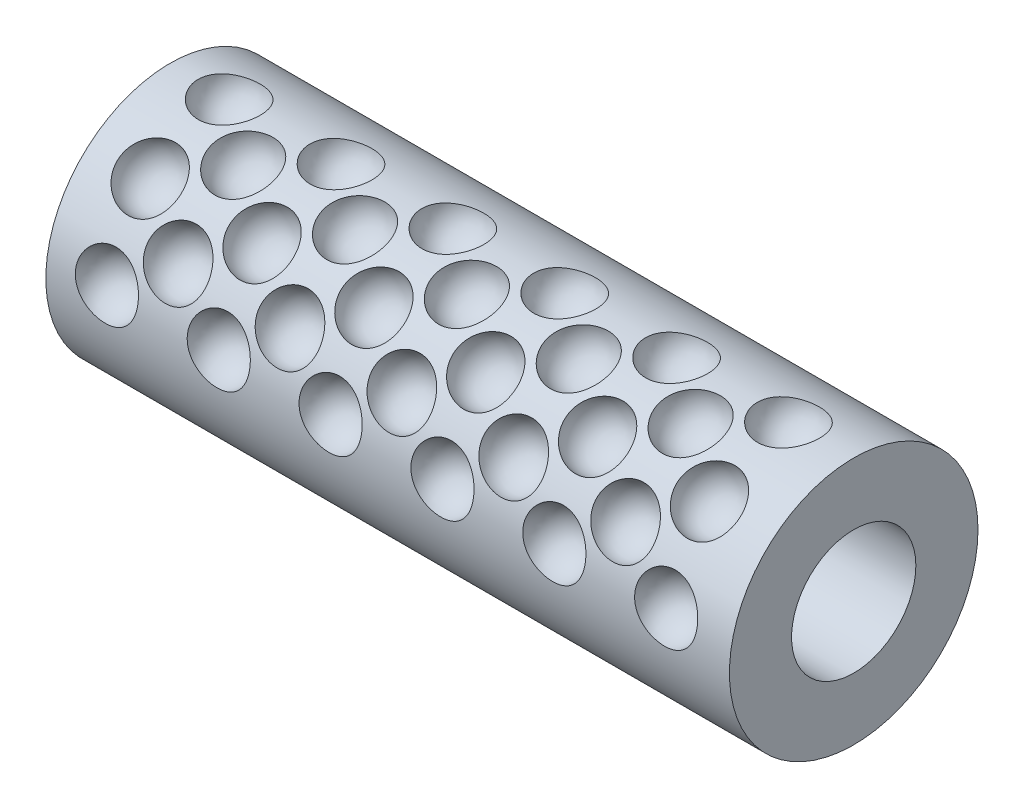
from build123d import *

# Parameters (mm, degrees)
SKETCH1_R           = 5.08
BOSS_EXTRUDE1_DEPTH = 13.97
LPATTERN1_COUNT     = 6
LPATTERN1_PITCH     = 4.572
CIRPATTERN1_COUNT   = 3
CIRPATTERN1_ANGLE   = 80
LPATTERN3_COUNT     = 5
LPATTERN3_PITCH     = 4.572
CIRPATTERN2_COUNT   = 2
CIRPATTERN2_ANGLE   = 40
SKETCH4_R           = 2.54
CUT_EXTRUDE1_DEPTH  = 29.848854529


with BuildPart() as part:
    # Sketch1 → Boss-Extrude1 (new, symmetric)
    with BuildSketch(Plane(origin=(0, 0, 0), x_dir=(0, 0, -1), z_dir=(1, 0, 0))):
        Circle(SKETCH1_R)
    extrude(amount=BOSS_EXTRUDE1_DEPTH, both=True)

    # Sketch7 → Primary Dimple (revolve, cut)
    with BuildSketch(Plane.ZY.offset(11.557)):
        with BuildLine():
            Line((0, 5.08), (0, 3.81))
            ThreePointArc((0, 3.81), (-0.898025612, 4.181974388), (-1.27, 5.08))
            Line((-1.27, 5.08), (-1.27, 5.441785192))
            Line((-1.27, 5.441785192), (0, 5.441785192))
            Line((0, 5.441785192), (0, 5.08))
        make_face()
    primary_dimple = revolve(axis=Axis((-11.557, 0, 0), (0, 1, 0)), mode=Mode.SUBTRACT)

    # LPattern1: Primary Dimple ×6
    with Locations(*[(i * LPATTERN1_PITCH, 0, 0) for i in range(1, LPATTERN1_COUNT)]):
        add(primary_dimple, mode=Mode.SUBTRACT)

    # CirPattern1: Primary Dimple ×3 about axis
    cirpattern1_axis = Axis((0, 0, 0), (1, 0, 0))
    for i in range(1, CIRPATTERN1_COUNT):
        add(primary_dimple.rotate(cirpattern1_axis, i * CIRPATTERN1_ANGLE / (CIRPATTERN1_COUNT - 1)), mode=Mode.SUBTRACT)

    # CirPattern1 copy 1 sketch → CirPattern1 copy 1 (revolve, cut)
    with BuildSketch(Plane(origin=(-6.985, 0, 0), x_dir=(-6.982962677686267e-15, -0.6427876096865406, 0.766044443118977), z_dir=(-1, 0, 0))):
        with BuildLine():
            Line((0, 5.08), (0, 3.81))
            ThreePointArc((0, 3.81), (-0.898025612, 4.181974388), (-1.27, 5.08))
            Line((-1.27, 5.08), (-1.27, 5.441785192))
            Line((-1.27, 5.441785192), (0, 5.441785192))
            Line((0, 5.441785192), (0, 5.08))
        make_face()
    revolve(axis=Axis((-6.985, 0, 0), (0, 0.766044443118977, 0.6427876096865406)), mode=Mode.SUBTRACT)

    # CirPattern1 copy 2 sketch → CirPattern1 copy 2 (revolve, cut)
    with BuildSketch(Plane(origin=(-6.985, 0, 0), x_dir=(-6.982962677686267e-15, -0.9848077530122086, 0.17364817766692714), z_dir=(-1, 0, 0))):
        with BuildLine():
            Line((0, 5.08), (0, 3.81))
            ThreePointArc((0, 3.81), (-0.898025612, 4.181974388), (-1.27, 5.08))
            Line((-1.27, 5.08), (-1.27, 5.441785192))
            Line((-1.27, 5.441785192), (0, 5.441785192))
            Line((0, 5.441785192), (0, 5.08))
        make_face()
    revolve(axis=Axis((-6.985, 0, 0), (0, 0.17364817766692714, 0.9848077530122086)), mode=Mode.SUBTRACT)

    # CirPattern1 copy 3 sketch → CirPattern1 copy 3 (revolve, cut)
    with BuildSketch(Plane(origin=(-2.413, 0, 0), x_dir=(-6.982962677686267e-15, -0.6427876096865406, 0.766044443118977), z_dir=(-1, 0, 0))):
        with BuildLine():
            Line((0, 5.08), (0, 3.81))
            ThreePointArc((0, 3.81), (-0.898025612, 4.181974388), (-1.27, 5.08))
            Line((-1.27, 5.08), (-1.27, 5.441785192))
            Line((-1.27, 5.441785192), (0, 5.441785192))
            Line((0, 5.441785192), (0, 5.08))
        make_face()
    revolve(axis=Axis((-2.413, 0, 0), (0, 0.766044443118977, 0.6427876096865406)), mode=Mode.SUBTRACT)

    # CirPattern1 copy 4 sketch → CirPattern1 copy 4 (revolve, cut)
    with BuildSketch(Plane(origin=(-2.413, 0, 0), x_dir=(-6.982962677686267e-15, -0.9848077530122086, 0.17364817766692714), z_dir=(-1, 0, 0))):
        with BuildLine():
            Line((0, 5.08), (0, 3.81))
            ThreePointArc((0, 3.81), (-0.898025612, 4.181974388), (-1.27, 5.08))
            Line((-1.27, 5.08), (-1.27, 5.441785192))
            Line((-1.27, 5.441785192), (0, 5.441785192))
            Line((0, 5.441785192), (0, 5.08))
        make_face()
    revolve(axis=Axis((-2.413, 0, 0), (0, 0.17364817766692714, 0.9848077530122086)), mode=Mode.SUBTRACT)

    # CirPattern1 copy 5 sketch → CirPattern1 copy 5 (revolve, cut)
    with BuildSketch(Plane(origin=(2.159, 0, 0), x_dir=(-6.982962677686267e-15, -0.6427876096865406, 0.766044443118977), z_dir=(-1, 0, 0))):
        with BuildLine():
            Line((0, 5.08), (0, 3.81))
            ThreePointArc((0, 3.81), (-0.898025612, 4.181974388), (-1.27, 5.08))
            Line((-1.27, 5.08), (-1.27, 5.441785192))
            Line((-1.27, 5.441785192), (0, 5.441785192))
            Line((0, 5.441785192), (0, 5.08))
        make_face()
    revolve(axis=Axis((2.159, 0, 0), (0, 0.766044443118977, 0.6427876096865406)), mode=Mode.SUBTRACT)

    # CirPattern1 copy 6 sketch → CirPattern1 copy 6 (revolve, cut)
    with BuildSketch(Plane(origin=(2.159, 0, 0), x_dir=(-6.982962677686267e-15, -0.9848077530122086, 0.17364817766692714), z_dir=(-1, 0, 0))):
        with BuildLine():
            Line((0, 5.08), (0, 3.81))
            ThreePointArc((0, 3.81), (-0.898025612, 4.181974388), (-1.27, 5.08))
            Line((-1.27, 5.08), (-1.27, 5.441785192))
            Line((-1.27, 5.441785192), (0, 5.441785192))
            Line((0, 5.441785192), (0, 5.08))
        make_face()
    revolve(axis=Axis((2.159, 0, 0), (0, 0.17364817766692714, 0.9848077530122086)), mode=Mode.SUBTRACT)

    # CirPattern1 copy 7 sketch → CirPattern1 copy 7 (revolve, cut)
    with BuildSketch(Plane(origin=(6.731, 0, 0), x_dir=(-6.982962677686267e-15, -0.6427876096865406, 0.766044443118977), z_dir=(-1, 0, 0))):
        with BuildLine():
            Line((0, 5.08), (0, 3.81))
            ThreePointArc((0, 3.81), (-0.898025612, 4.181974388), (-1.27, 5.08))
            Line((-1.27, 5.08), (-1.27, 5.441785192))
            Line((-1.27, 5.441785192), (0, 5.441785192))
            Line((0, 5.441785192), (0, 5.08))
        make_face()
    revolve(axis=Axis((6.731, 0, 0), (0, 0.766044443118977, 0.6427876096865406)), mode=Mode.SUBTRACT)

    # CirPattern1 copy 8 sketch → CirPattern1 copy 8 (revolve, cut)
    with BuildSketch(Plane(origin=(6.731, 0, 0), x_dir=(-6.982962677686267e-15, -0.9848077530122086, 0.17364817766692714), z_dir=(-1, 0, 0))):
        with BuildLine():
            Line((0, 5.08), (0, 3.81))
            ThreePointArc((0, 3.81), (-0.898025612, 4.181974388), (-1.27, 5.08))
            Line((-1.27, 5.08), (-1.27, 5.441785192))
            Line((-1.27, 5.441785192), (0, 5.441785192))
            Line((0, 5.441785192), (0, 5.08))
        make_face()
    revolve(axis=Axis((6.731, 0, 0), (0, 0.17364817766692714, 0.9848077530122086)), mode=Mode.SUBTRACT)

    # CirPattern1 copy 9 sketch → CirPattern1 copy 9 (revolve, cut)
    with BuildSketch(Plane(origin=(11.303, 0, 0), x_dir=(-6.982962677686267e-15, -0.6427876096865406, 0.766044443118977), z_dir=(-1, 0, 0))):
        with BuildLine():
            Line((0, 5.08), (0, 3.81))
            ThreePointArc((0, 3.81), (-0.898025612, 4.181974388), (-1.27, 5.08))
            Line((-1.27, 5.08), (-1.27, 5.441785192))
            Line((-1.27, 5.441785192), (0, 5.441785192))
            Line((0, 5.441785192), (0, 5.08))
        make_face()
    revolve(axis=Axis((11.303, 0, 0), (0, 0.766044443118977, 0.6427876096865406)), mode=Mode.SUBTRACT)

    # CirPattern1 copy 10 sketch → CirPattern1 copy 10 (revolve, cut)
    with BuildSketch(Plane(origin=(11.303, 0, 0), x_dir=(-6.982962677686267e-15, -0.9848077530122086, 0.17364817766692714), z_dir=(-1, 0, 0))):
        with BuildLine():
            Line((0, 5.08), (0, 3.81))
            ThreePointArc((0, 3.81), (-0.898025612, 4.181974388), (-1.27, 5.08))
            Line((-1.27, 5.08), (-1.27, 5.441785192))
            Line((-1.27, 5.441785192), (0, 5.441785192))
            Line((0, 5.441785192), (0, 5.08))
        make_face()
    revolve(axis=Axis((11.303, 0, 0), (0, 0.17364817766692714, 0.9848077530122086)), mode=Mode.SUBTRACT)

    # Mirror3: Primary Dimple across plane
    add(primary_dimple.mirror(Plane(origin=(0, 0, 0), x_dir=(0, -0.7071067811865561, 0.7071067811865389), z_dir=(0, 0.7071067811865389, 0.7071067811865561))), mode=Mode.SUBTRACT)

    # Mirror3 copy 1 sketch → Mirror3 copy 1 (revolve, cut)
    with BuildSketch(Plane(origin=(-6.985, 0, 0), x_dir=(0, -1, 0), z_dir=(-1, 0, 0))):
        with BuildLine():
            Line((0, -5.08), (0, -3.81))
            ThreePointArc((0, -3.81), (-0.898025612, -4.181974388), (-1.27, -5.08))
            Line((-1.27, -5.08), (-1.27, -5.441785192))
            Line((-1.27, -5.441785192), (0, -5.441785192))
            Line((0, -5.441785192), (0, -5.08))
        make_face()
    revolve(axis=Axis((-6.985, 0, 0), (0, 0, 1)), mode=Mode.SUBTRACT)

    # Mirror3 copy 2 sketch → Mirror3 copy 2 (revolve, cut)
    with BuildSketch(Plane(origin=(-2.413, 0, 0), x_dir=(0, -1, 0), z_dir=(-1, 0, 0))):
        with BuildLine():
            Line((0, -5.08), (0, -3.81))
            ThreePointArc((0, -3.81), (-0.898025612, -4.181974388), (-1.27, -5.08))
            Line((-1.27, -5.08), (-1.27, -5.441785192))
            Line((-1.27, -5.441785192), (0, -5.441785192))
            Line((0, -5.441785192), (0, -5.08))
        make_face()
    revolve(axis=Axis((-2.413, 0, 0), (0, 0, 1)), mode=Mode.SUBTRACT)

    # Mirror3 copy 3 sketch → Mirror3 copy 3 (revolve, cut)
    with BuildSketch(Plane(origin=(2.159, 0, 0), x_dir=(0, -1, 0), z_dir=(-1, 0, 0))):
        with BuildLine():
            Line((0, -5.08), (0, -3.81))
            ThreePointArc((0, -3.81), (-0.898025612, -4.181974388), (-1.27, -5.08))
            Line((-1.27, -5.08), (-1.27, -5.441785192))
            Line((-1.27, -5.441785192), (0, -5.441785192))
            Line((0, -5.441785192), (0, -5.08))
        make_face()
    revolve(axis=Axis((2.159, 0, 0), (0, 0, 1)), mode=Mode.SUBTRACT)

    # Mirror3 copy 4 sketch → Mirror3 copy 4 (revolve, cut)
    with BuildSketch(Plane(origin=(6.731, 0, 0), x_dir=(0, -1, 0), z_dir=(-1, 0, 0))):
        with BuildLine():
            Line((0, -5.08), (0, -3.81))
            ThreePointArc((0, -3.81), (-0.898025612, -4.181974388), (-1.27, -5.08))
            Line((-1.27, -5.08), (-1.27, -5.441785192))
            Line((-1.27, -5.441785192), (0, -5.441785192))
            Line((0, -5.441785192), (0, -5.08))
        make_face()
    revolve(axis=Axis((6.731, 0, 0), (0, 0, 1)), mode=Mode.SUBTRACT)

    # Mirror3 copy 5 sketch → Mirror3 copy 5 (revolve, cut)
    with BuildSketch(Plane(origin=(11.303, 0, 0), x_dir=(0, -1, 0), z_dir=(-1, 0, 0))):
        with BuildLine():
            Line((0, -5.08), (0, -3.81))
            ThreePointArc((0, -3.81), (-0.898025612, -4.181974388), (-1.27, -5.08))
            Line((-1.27, -5.08), (-1.27, -5.441785192))
            Line((-1.27, -5.441785192), (0, -5.441785192))
            Line((0, -5.441785192), (0, -5.08))
        make_face()
    revolve(axis=Axis((11.303, 0, 0), (0, 0, 1)), mode=Mode.SUBTRACT)

    # Mirror3 copy 6 sketch → Mirror3 copy 6 (revolve, cut)
    with BuildSketch(Plane(origin=(-11.557, 0, 0), x_dir=(-6.982962677686267e-15, -0.7660444431189927, 0.6427876096865218), z_dir=(-1, 0, 0))):
        with BuildLine():
            Line((0, -5.08), (0, -3.81))
            ThreePointArc((0, -3.81), (-0.898025612, -4.181974388), (-1.27, -5.08))
            Line((-1.27, -5.08), (-1.27, -5.441785192))
            Line((-1.27, -5.441785192), (0, -5.441785192))
            Line((0, -5.441785192), (0, -5.08))
        make_face()
    revolve(axis=Axis((-11.557, 0, 0), (0, 0.6427876096865219, 0.7660444431189927)), mode=Mode.SUBTRACT)

    # Mirror3 copy 7 sketch → Mirror3 copy 7 (revolve, cut)
    with BuildSketch(Plane(origin=(-11.557, 0, 0), x_dir=(-6.982962677686267e-15, -0.1736481776669511, 0.9848077530122044), z_dir=(-1, 0, 0))):
        with BuildLine():
            Line((0, -5.08), (0, -3.81))
            ThreePointArc((0, -3.81), (-0.898025612, -4.181974388), (-1.27, -5.08))
            Line((-1.27, -5.08), (-1.27, -5.441785192))
            Line((-1.27, -5.441785192), (0, -5.441785192))
            Line((0, -5.441785192), (0, -5.08))
        make_face()
    revolve(axis=Axis((-11.557, 0, 0), (0, 0.9848077530122044, 0.1736481776669512)), mode=Mode.SUBTRACT)

    # Mirror3 copy 8 sketch → Mirror3 copy 8 (revolve, cut)
    with BuildSketch(Plane(origin=(-6.985, 0, 0), x_dir=(-6.982962677686267e-15, -0.7660444431189927, 0.6427876096865218), z_dir=(-1, 0, 0))):
        with BuildLine():
            Line((0, -5.08), (0, -3.81))
            ThreePointArc((0, -3.81), (-0.898025612, -4.181974388), (-1.27, -5.08))
            Line((-1.27, -5.08), (-1.27, -5.441785192))
            Line((-1.27, -5.441785192), (0, -5.441785192))
            Line((0, -5.441785192), (0, -5.08))
        make_face()
    revolve(axis=Axis((-6.985, 0, 0), (0, 0.6427876096865219, 0.7660444431189927)), mode=Mode.SUBTRACT)

    # Mirror3 copy 9 sketch → Mirror3 copy 9 (revolve, cut)
    with BuildSketch(Plane(origin=(-6.985, 0, 0), x_dir=(-6.982962677686267e-15, -0.1736481776669511, 0.9848077530122044), z_dir=(-1, 0, 0))):
        with BuildLine():
            Line((0, -5.08), (0, -3.81))
            ThreePointArc((0, -3.81), (-0.898025612, -4.181974388), (-1.27, -5.08))
            Line((-1.27, -5.08), (-1.27, -5.441785192))
            Line((-1.27, -5.441785192), (0, -5.441785192))
            Line((0, -5.441785192), (0, -5.08))
        make_face()
    revolve(axis=Axis((-6.985, 0, 0), (0, 0.9848077530122044, 0.1736481776669512)), mode=Mode.SUBTRACT)

    # Mirror3 copy 10 sketch → Mirror3 copy 10 (revolve, cut)
    with BuildSketch(Plane(origin=(-2.413, 0, 0), x_dir=(-6.982962677686267e-15, -0.7660444431189927, 0.6427876096865218), z_dir=(-1, 0, 0))):
        with BuildLine():
            Line((0, -5.08), (0, -3.81))
            ThreePointArc((0, -3.81), (-0.898025612, -4.181974388), (-1.27, -5.08))
            Line((-1.27, -5.08), (-1.27, -5.441785192))
            Line((-1.27, -5.441785192), (0, -5.441785192))
            Line((0, -5.441785192), (0, -5.08))
        make_face()
    revolve(axis=Axis((-2.413, 0, 0), (0, 0.6427876096865219, 0.7660444431189927)), mode=Mode.SUBTRACT)

    # Mirror3 copy 11 sketch → Mirror3 copy 11 (revolve, cut)
    with BuildSketch(Plane(origin=(-2.413, 0, 0), x_dir=(-6.982962677686267e-15, -0.1736481776669511, 0.9848077530122044), z_dir=(-1, 0, 0))):
        with BuildLine():
            Line((0, -5.08), (0, -3.81))
            ThreePointArc((0, -3.81), (-0.898025612, -4.181974388), (-1.27, -5.08))
            Line((-1.27, -5.08), (-1.27, -5.441785192))
            Line((-1.27, -5.441785192), (0, -5.441785192))
            Line((0, -5.441785192), (0, -5.08))
        make_face()
    revolve(axis=Axis((-2.413, 0, 0), (0, 0.9848077530122044, 0.1736481776669512)), mode=Mode.SUBTRACT)

    # Mirror3 copy 12 sketch → Mirror3 copy 12 (revolve, cut)
    with BuildSketch(Plane(origin=(2.159, 0, 0), x_dir=(-6.982962677686267e-15, -0.7660444431189927, 0.6427876096865218), z_dir=(-1, 0, 0))):
        with BuildLine():
            Line((0, -5.08), (0, -3.81))
            ThreePointArc((0, -3.81), (-0.898025612, -4.181974388), (-1.27, -5.08))
            Line((-1.27, -5.08), (-1.27, -5.441785192))
            Line((-1.27, -5.441785192), (0, -5.441785192))
            Line((0, -5.441785192), (0, -5.08))
        make_face()
    revolve(axis=Axis((2.159, 0, 0), (0, 0.6427876096865219, 0.7660444431189927)), mode=Mode.SUBTRACT)

    # Mirror3 copy 13 sketch → Mirror3 copy 13 (revolve, cut)
    with BuildSketch(Plane(origin=(2.159, 0, 0), x_dir=(-6.982962677686267e-15, -0.1736481776669511, 0.9848077530122044), z_dir=(-1, 0, 0))):
        with BuildLine():
            Line((0, -5.08), (0, -3.81))
            ThreePointArc((0, -3.81), (-0.898025612, -4.181974388), (-1.27, -5.08))
            Line((-1.27, -5.08), (-1.27, -5.441785192))
            Line((-1.27, -5.441785192), (0, -5.441785192))
            Line((0, -5.441785192), (0, -5.08))
        make_face()
    revolve(axis=Axis((2.159, 0, 0), (0, 0.9848077530122044, 0.1736481776669512)), mode=Mode.SUBTRACT)

    # Mirror3 copy 14 sketch → Mirror3 copy 14 (revolve, cut)
    with BuildSketch(Plane(origin=(6.731, 0, 0), x_dir=(-6.982962677686267e-15, -0.7660444431189927, 0.6427876096865218), z_dir=(-1, 0, 0))):
        with BuildLine():
            Line((0, -5.08), (0, -3.81))
            ThreePointArc((0, -3.81), (-0.898025612, -4.181974388), (-1.27, -5.08))
            Line((-1.27, -5.08), (-1.27, -5.441785192))
            Line((-1.27, -5.441785192), (0, -5.441785192))
            Line((0, -5.441785192), (0, -5.08))
        make_face()
    revolve(axis=Axis((6.731, 0, 0), (0, 0.6427876096865219, 0.7660444431189927)), mode=Mode.SUBTRACT)

    # Mirror3 copy 15 sketch → Mirror3 copy 15 (revolve, cut)
    with BuildSketch(Plane(origin=(6.731, 0, 0), x_dir=(-6.982962677686267e-15, -0.1736481776669511, 0.9848077530122044), z_dir=(-1, 0, 0))):
        with BuildLine():
            Line((0, -5.08), (0, -3.81))
            ThreePointArc((0, -3.81), (-0.898025612, -4.181974388), (-1.27, -5.08))
            Line((-1.27, -5.08), (-1.27, -5.441785192))
            Line((-1.27, -5.441785192), (0, -5.441785192))
            Line((0, -5.441785192), (0, -5.08))
        make_face()
    revolve(axis=Axis((6.731, 0, 0), (0, 0.9848077530122044, 0.1736481776669512)), mode=Mode.SUBTRACT)

    # Mirror3 copy 16 sketch → Mirror3 copy 16 (revolve, cut)
    with BuildSketch(Plane(origin=(11.303, 0, 0), x_dir=(-6.982962677686267e-15, -0.7660444431189927, 0.6427876096865218), z_dir=(-1, 0, 0))):
        with BuildLine():
            Line((0, -5.08), (0, -3.81))
            ThreePointArc((0, -3.81), (-0.898025612, -4.181974388), (-1.27, -5.08))
            Line((-1.27, -5.08), (-1.27, -5.441785192))
            Line((-1.27, -5.441785192), (0, -5.441785192))
            Line((0, -5.441785192), (0, -5.08))
        make_face()
    revolve(axis=Axis((11.303, 0, 0), (0, 0.6427876096865219, 0.7660444431189927)), mode=Mode.SUBTRACT)

    # Mirror3 copy 17 sketch → Mirror3 copy 17 (revolve, cut)
    with BuildSketch(Plane(origin=(11.303, 0, 0), x_dir=(-6.982962677686267e-15, -0.1736481776669511, 0.9848077530122044), z_dir=(-1, 0, 0))):
        with BuildLine():
            Line((0, -5.08), (0, -3.81))
            ThreePointArc((0, -3.81), (-0.898025612, -4.181974388), (-1.27, -5.08))
            Line((-1.27, -5.08), (-1.27, -5.441785192))
            Line((-1.27, -5.441785192), (0, -5.441785192))
            Line((0, -5.441785192), (0, -5.08))
        make_face()
    revolve(axis=Axis((11.303, 0, 0), (0, 0.9848077530122044, 0.1736481776669512)), mode=Mode.SUBTRACT)

    # Sketch13 → Secondary Dimple (revolve, cut)
    with BuildSketch(Plane.ZY.offset(9.271)):
        with BuildLine():
            Line((1.737462328, 4.773638514), (1.303096746, 3.580228885))
            ThreePointArc((1.303096746, 3.580228885), (0.586451439, 4.236913321), (0.5440527, 5.208004096))
            Line((0.5440527, 5.208004096), (0.665675063, 5.542158792))
            Line((0.665675063, 5.542158792), (1.859084691, 5.10779321))
            Line((1.859084691, 5.10779321), (1.737462328, 4.773638514))
        make_face()
    secondary_dimple = revolve(axis=Axis((-9.271, 2.139091027, 0.778565462), (-2.3065863022557455e-15, 0.9396926207859081, 0.34202014332566943)), mode=Mode.SUBTRACT)

    # LPattern3: Secondary Dimple ×5
    with Locations(*[(i * LPATTERN3_PITCH, 0, 0) for i in range(1, LPATTERN3_COUNT)]):
        add(secondary_dimple, mode=Mode.SUBTRACT)

    # CirPattern2: Secondary Dimple ×2 about axis
    cirpattern2_axis = Axis((-13.97, 0, 0), (1, 0, 0))
    for i in range(1, CIRPATTERN2_COUNT):
        add(secondary_dimple.rotate(cirpattern2_axis, i * CIRPATTERN2_ANGLE / (CIRPATTERN2_COUNT - 1)), mode=Mode.SUBTRACT)

    # CirPattern2 copy 1 sketch → CirPattern2 copy 1 (revolve, cut)
    with BuildSketch(Plane(origin=(-4.699, 0, 0), x_dir=(-6.982962677686267e-15, -0.6427876096865406, 0.766044443118977), z_dir=(-1, 0, 0))):
        with BuildLine():
            Line((1.737462328, 4.773638514), (1.303096746, 3.580228885))
            ThreePointArc((1.303096746, 3.580228885), (0.586451439, 4.236913321), (0.5440527, 5.208004096))
            Line((0.5440527, 5.208004096), (0.665675063, 5.542158792))
            Line((0.665675063, 5.542158792), (1.859084691, 5.10779321))
            Line((1.859084691, 5.10779321), (1.737462328, 4.773638514))
        make_face()
    revolve(axis=Axis((-4.699, 1.138186562, 1.971396954), (-2.3065863022557455e-15, 0.4999999999999979, 0.8660254037844399)), mode=Mode.SUBTRACT)

    # CirPattern2 copy 2 sketch → CirPattern2 copy 2 (revolve, cut)
    with BuildSketch(Plane(origin=(-0.127, 0, 0), x_dir=(-6.982962677686267e-15, -0.6427876096865406, 0.766044443118977), z_dir=(-1, 0, 0))):
        with BuildLine():
            Line((1.737462328, 4.773638514), (1.303096746, 3.580228885))
            ThreePointArc((1.303096746, 3.580228885), (0.586451439, 4.236913321), (0.5440527, 5.208004096))
            Line((0.5440527, 5.208004096), (0.665675063, 5.542158792))
            Line((0.665675063, 5.542158792), (1.859084691, 5.10779321))
            Line((1.859084691, 5.10779321), (1.737462328, 4.773638514))
        make_face()
    revolve(axis=Axis((-0.127, 1.138186562, 1.971396954), (-2.3065863022557455e-15, 0.4999999999999979, 0.8660254037844399)), mode=Mode.SUBTRACT)

    # CirPattern2 copy 3 sketch → CirPattern2 copy 3 (revolve, cut)
    with BuildSketch(Plane(origin=(4.445, 0, 0), x_dir=(-6.982962677686267e-15, -0.6427876096865406, 0.766044443118977), z_dir=(-1, 0, 0))):
        with BuildLine():
            Line((1.737462328, 4.773638514), (1.303096746, 3.580228885))
            ThreePointArc((1.303096746, 3.580228885), (0.586451439, 4.236913321), (0.5440527, 5.208004096))
            Line((0.5440527, 5.208004096), (0.665675063, 5.542158792))
            Line((0.665675063, 5.542158792), (1.859084691, 5.10779321))
            Line((1.859084691, 5.10779321), (1.737462328, 4.773638514))
        make_face()
    revolve(axis=Axis((4.445, 1.138186562, 1.971396954), (-2.3065863022557455e-15, 0.4999999999999979, 0.8660254037844399)), mode=Mode.SUBTRACT)

    # CirPattern2 copy 4 sketch → CirPattern2 copy 4 (revolve, cut)
    with BuildSketch(Plane(origin=(9.017, 0, 0), x_dir=(-6.982962677686267e-15, -0.6427876096865406, 0.766044443118977), z_dir=(-1, 0, 0))):
        with BuildLine():
            Line((1.737462328, 4.773638514), (1.303096746, 3.580228885))
            ThreePointArc((1.303096746, 3.580228885), (0.586451439, 4.236913321), (0.5440527, 5.208004096))
            Line((0.5440527, 5.208004096), (0.665675063, 5.542158792))
            Line((0.665675063, 5.542158792), (1.859084691, 5.10779321))
            Line((1.859084691, 5.10779321), (1.737462328, 4.773638514))
        make_face()
    revolve(axis=Axis((9.017, 1.138186562, 1.971396954), (-2.3065863022557455e-15, 0.4999999999999979, 0.8660254037844399)), mode=Mode.SUBTRACT)

    # Mirror4: Secondary Dimple across plane
    add(secondary_dimple.mirror(Plane(origin=(0, 0, 0), x_dir=(0, -0.7071067811865561, 0.7071067811865389), z_dir=(0, 0.7071067811865389, 0.7071067811865561))), mode=Mode.SUBTRACT)

    # Mirror4 copy 1 sketch → Mirror4 copy 1 (revolve, cut)
    with BuildSketch(Plane(origin=(-4.699, 0, 0), x_dir=(0, -1, 0), z_dir=(-1, 0, 0))):
        with BuildLine():
            Line((1.737462328, -4.773638514), (1.303096746, -3.580228885))
            ThreePointArc((1.303096746, -3.580228885), (0.586451439, -4.236913321), (0.5440527, -5.208004096))
            Line((0.5440527, -5.208004096), (0.665675063, -5.542158792))
            Line((0.665675063, -5.542158792), (1.859084691, -5.10779321))
            Line((1.859084691, -5.10779321), (1.737462328, -4.773638514))
        make_face()
    revolve(axis=Axis((-4.699, -0.778565462, -2.139091027), (2.3065863022557455e-15, 0.34202014332564656, 0.9396926207859164)), mode=Mode.SUBTRACT)

    # Mirror4 copy 2 sketch → Mirror4 copy 2 (revolve, cut)
    with BuildSketch(Plane(origin=(-0.127, 0, 0), x_dir=(0, -1, 0), z_dir=(-1, 0, 0))):
        with BuildLine():
            Line((1.737462328, -4.773638514), (1.303096746, -3.580228885))
            ThreePointArc((1.303096746, -3.580228885), (0.586451439, -4.236913321), (0.5440527, -5.208004096))
            Line((0.5440527, -5.208004096), (0.665675063, -5.542158792))
            Line((0.665675063, -5.542158792), (1.859084691, -5.10779321))
            Line((1.859084691, -5.10779321), (1.737462328, -4.773638514))
        make_face()
    revolve(axis=Axis((-0.127, -0.778565462, -2.139091027), (2.3065863022557455e-15, 0.34202014332564656, 0.9396926207859164)), mode=Mode.SUBTRACT)

    # Mirror4 copy 3 sketch → Mirror4 copy 3 (revolve, cut)
    with BuildSketch(Plane(origin=(4.445, 0, 0), x_dir=(0, -1, 0), z_dir=(-1, 0, 0))):
        with BuildLine():
            Line((1.737462328, -4.773638514), (1.303096746, -3.580228885))
            ThreePointArc((1.303096746, -3.580228885), (0.586451439, -4.236913321), (0.5440527, -5.208004096))
            Line((0.5440527, -5.208004096), (0.665675063, -5.542158792))
            Line((0.665675063, -5.542158792), (1.859084691, -5.10779321))
            Line((1.859084691, -5.10779321), (1.737462328, -4.773638514))
        make_face()
    revolve(axis=Axis((4.445, -0.778565462, -2.139091027), (2.3065863022557455e-15, 0.34202014332564656, 0.9396926207859164)), mode=Mode.SUBTRACT)

    # Mirror4 copy 4 sketch → Mirror4 copy 4 (revolve, cut)
    with BuildSketch(Plane(origin=(9.017, 0, 0), x_dir=(0, -1, 0), z_dir=(-1, 0, 0))):
        with BuildLine():
            Line((1.737462328, -4.773638514), (1.303096746, -3.580228885))
            ThreePointArc((1.303096746, -3.580228885), (0.586451439, -4.236913321), (0.5440527, -5.208004096))
            Line((0.5440527, -5.208004096), (0.665675063, -5.542158792))
            Line((0.665675063, -5.542158792), (1.859084691, -5.10779321))
            Line((1.859084691, -5.10779321), (1.737462328, -4.773638514))
        make_face()
    revolve(axis=Axis((9.017, -0.778565462, -2.139091027), (2.3065863022557455e-15, 0.34202014332564656, 0.9396926207859164)), mode=Mode.SUBTRACT)

    # Mirror4 copy 5 sketch → Mirror4 copy 5 (revolve, cut)
    with BuildSketch(Plane(origin=(-9.271, 0, 0), x_dir=(-6.982962677686267e-15, -0.7660444431189927, 0.6427876096865218), z_dir=(-1, 0, 0))):
        with BuildLine():
            Line((1.737462328, -4.773638514), (1.303096746, -3.580228885))
            ThreePointArc((1.303096746, -3.580228885), (0.586451439, -4.236913321), (0.5440527, -5.208004096))
            Line((0.5440527, -5.208004096), (0.665675063, -5.542158792))
            Line((0.665675063, -5.542158792), (1.859084691, -5.10779321))
            Line((1.859084691, -5.10779321), (1.737462328, -4.773638514))
        make_face()
    revolve(axis=Axis((-9.271, -1.971396954, -1.138186562), (2.3065863022557455e-15, 0.8660254037844277, 0.5000000000000191)), mode=Mode.SUBTRACT)

    # Mirror4 copy 6 sketch → Mirror4 copy 6 (revolve, cut)
    with BuildSketch(Plane(origin=(-4.699, 0, 0), x_dir=(-6.982962677686267e-15, -0.7660444431189927, 0.6427876096865218), z_dir=(-1, 0, 0))):
        with BuildLine():
            Line((1.737462328, -4.773638514), (1.303096746, -3.580228885))
            ThreePointArc((1.303096746, -3.580228885), (0.586451439, -4.236913321), (0.5440527, -5.208004096))
            Line((0.5440527, -5.208004096), (0.665675063, -5.542158792))
            Line((0.665675063, -5.542158792), (1.859084691, -5.10779321))
            Line((1.859084691, -5.10779321), (1.737462328, -4.773638514))
        make_face()
    revolve(axis=Axis((-4.699, -1.971396954, -1.138186562), (2.3065863022557455e-15, 0.8660254037844277, 0.5000000000000191)), mode=Mode.SUBTRACT)

    # Mirror4 copy 7 sketch → Mirror4 copy 7 (revolve, cut)
    with BuildSketch(Plane(origin=(-0.127, 0, 0), x_dir=(-6.982962677686267e-15, -0.7660444431189927, 0.6427876096865218), z_dir=(-1, 0, 0))):
        with BuildLine():
            Line((1.737462328, -4.773638514), (1.303096746, -3.580228885))
            ThreePointArc((1.303096746, -3.580228885), (0.586451439, -4.236913321), (0.5440527, -5.208004096))
            Line((0.5440527, -5.208004096), (0.665675063, -5.542158792))
            Line((0.665675063, -5.542158792), (1.859084691, -5.10779321))
            Line((1.859084691, -5.10779321), (1.737462328, -4.773638514))
        make_face()
    revolve(axis=Axis((-0.127, -1.971396954, -1.138186562), (2.3065863022557455e-15, 0.8660254037844277, 0.5000000000000191)), mode=Mode.SUBTRACT)

    # Mirror4 copy 8 sketch → Mirror4 copy 8 (revolve, cut)
    with BuildSketch(Plane(origin=(4.445, 0, 0), x_dir=(-6.982962677686267e-15, -0.7660444431189927, 0.6427876096865218), z_dir=(-1, 0, 0))):
        with BuildLine():
            Line((1.737462328, -4.773638514), (1.303096746, -3.580228885))
            ThreePointArc((1.303096746, -3.580228885), (0.586451439, -4.236913321), (0.5440527, -5.208004096))
            Line((0.5440527, -5.208004096), (0.665675063, -5.542158792))
            Line((0.665675063, -5.542158792), (1.859084691, -5.10779321))
            Line((1.859084691, -5.10779321), (1.737462328, -4.773638514))
        make_face()
    revolve(axis=Axis((4.445, -1.971396954, -1.138186562), (2.3065863022557455e-15, 0.8660254037844277, 0.5000000000000191)), mode=Mode.SUBTRACT)

    # Mirror4 copy 9 sketch → Mirror4 copy 9 (revolve, cut)
    with BuildSketch(Plane(origin=(9.017, 0, 0), x_dir=(-6.982962677686267e-15, -0.7660444431189927, 0.6427876096865218), z_dir=(-1, 0, 0))):
        with BuildLine():
            Line((1.737462328, -4.773638514), (1.303096746, -3.580228885))
            ThreePointArc((1.303096746, -3.580228885), (0.586451439, -4.236913321), (0.5440527, -5.208004096))
            Line((0.5440527, -5.208004096), (0.665675063, -5.542158792))
            Line((0.665675063, -5.542158792), (1.859084691, -5.10779321))
            Line((1.859084691, -5.10779321), (1.737462328, -4.773638514))
        make_face()
    revolve(axis=Axis((9.017, -1.971396954, -1.138186562), (2.3065863022557455e-15, 0.8660254037844277, 0.5000000000000191)), mode=Mode.SUBTRACT)

    # Sketch4 → Cut-Extrude1 (cut, through all)
    with BuildSketch(Plane(origin=(13.97, 0, 0), x_dir=(0, 0, -1), z_dir=(1, 0, 0))):
        Circle(SKETCH4_R)
    extrude(amount=-CUT_EXTRUDE1_DEPTH, mode=Mode.SUBTRACT)


solid = part.part
